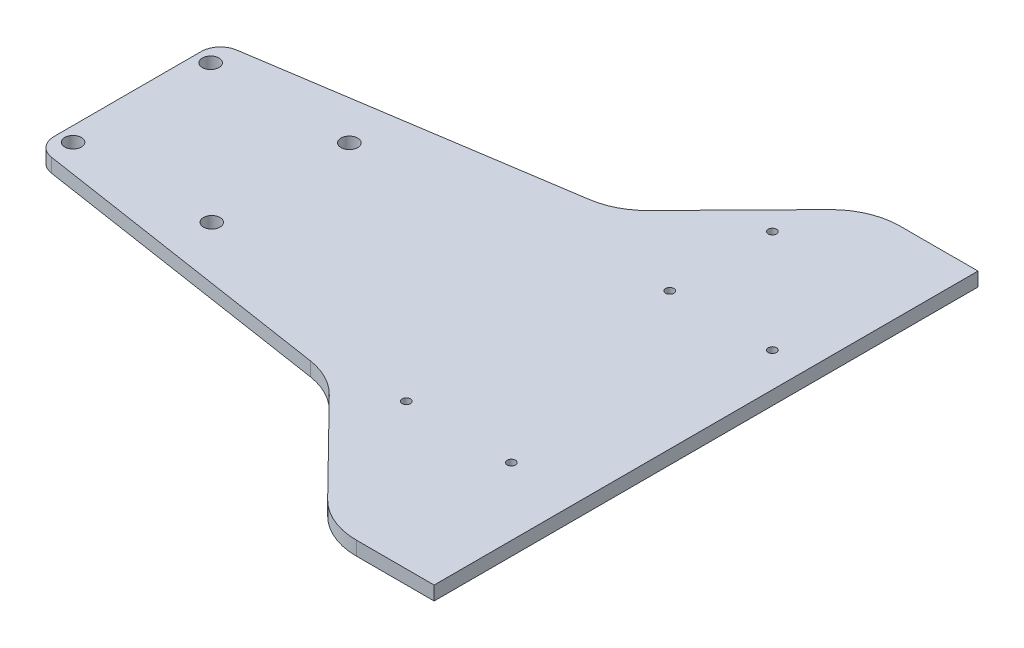
from build123d import *

# Parameters (mm, degrees)
BOSS_EXTRU_1_DEPTH      = 5
CONG_3_R                = 7
ESQUISSE3_R             = 3
ENL_V_MAT_EXTRU_1_DEPTH = 5
ESQUISSE8_R             = 1.5
ENL_V_MAT_EXTRU_5_DEPTH = 10
ESQUISSE11_R            = 1.5
ENL_V_MAT_EXTRU_7_DEPTH = 10
ESQUISSE12_W            = 8.513232075
ESQUISSE12_H            = 196.02308235
BOSS_EXTRU_2_DEPTH      = 5


with BuildPart() as part:
    # Esquisse1 → Boss.-Extru.1 (new body)
    with BuildSketch(Plane(origin=(0, 0, 0), x_dir=(1, 0, 0), z_dir=(0, 1, 0))):
        with BuildLine():
            Line((200, 98), (180.486918987, 98))
            ThreePointArc((180.486918987, 98), (170.816361757, 96.053857006), (162.651427502, 90.518425828))
            Line((162.651427502, 90.518425828), (130.227508241, 57.507666668))
            ThreePointArc((130.227508241, 57.507666668), (123.786759953, 52.773905469), (116.181163829, 50.314913559))
            Line((116.181163829, 50.314913559), (0, 32.5))
            Line((0, 32.5), (0, 19.62474242))
            Line((0, 19.62474242), (0, -19.62474242))
            Line((0, -19.62474242), (0, -32.5))
            Line((0, -32.5), (116.181163829, -50.314913559))
            ThreePointArc((116.181163829, -50.314913559), (123.786759953, -52.773905469), (130.227508241, -57.507666668))
            Line((130.227508241, -57.507666668), (162.651427502, -90.518425828))
            ThreePointArc((162.651427502, -90.518425828), (170.816361757, -96.053857006), (180.486918987, -98))
            Line((180.486918987, -98), (200, -98))
            Line((200, -98), (200, 98))
        make_face()
    extrude(amount=BOSS_EXTRU_1_DEPTH)

    # Congé3
    cong_3_edges = [part.edges().sort_by_distance(p)[0] for p in [
        (0, 2.5, 32.5),
        (0, 2.5, -32.5),
    ]]
    fillet(cong_3_edges, radius=CONG_3_R)

    # Esquisse3 → Enlèv. mat.-Extru.1 (cut)
    with BuildSketch(Plane(origin=(0, 5, 0), x_dir=(1, 0, 0), z_dir=(0, 1, 0))):
        with Locations((5.228132429, -24.85729672)):
            Circle(ESQUISSE3_R)
        with Locations((5.228132429, 24.743581245)):
            Circle(ESQUISSE3_R)
        with Locations((55.20842969, -24.85729672)):
            Circle(ESQUISSE3_R)
        with Locations((55.20842969, 24.743581245)):
            Circle(ESQUISSE3_R)
    extrude(amount=-ENL_V_MAT_EXTRU_1_DEPTH, mode=Mode.SUBTRACT)

    # Esquisse8 → Enlèv. mat.-Extru.5 (cut)
    with BuildSketch(Plane(origin=(0, 5, 0), x_dir=(1, 0, 0), z_dir=(0, 1, 0))):
        with Locations((196.148923391, 36.274574464)):
            Circle(ESQUISSE8_R)
        with Locations((159.148923391, 73.274574464)):
            Circle(ESQUISSE8_R)
        with Locations((159.148923391, 36.274574464)):
            Circle(ESQUISSE8_R)
    extrude(amount=-ENL_V_MAT_EXTRU_5_DEPTH, mode=Mode.SUBTRACT)

    # Esquisse11 → Enlèv. mat.-Extru.7 (cut)
    with BuildSketch(Plane(origin=(0, 5, 0), x_dir=(1, 0, 0), z_dir=(0, 1, 0))):
        with Locations((184.199116652, -45.869762424)):
            Circle(ESQUISSE11_R)
        with Locations((146.150097665, -45.660518454)):
            Circle(ESQUISSE11_R)
    extrude(amount=-ENL_V_MAT_EXTRU_7_DEPTH, mode=Mode.SUBTRACT)

    # Esquisse12 → Boss.-Extru.2 (add)
    with BuildSketch(Plane(origin=(0, 0, 0), x_dir=(-1, 0, 0), z_dir=(0, -1, 0))):
        with Locations((-204.256616038, 0.011541175)):
            Rectangle(ESQUISSE12_W, ESQUISSE12_H)
    extrude(amount=-BOSS_EXTRU_2_DEPTH)


solid = part.part
